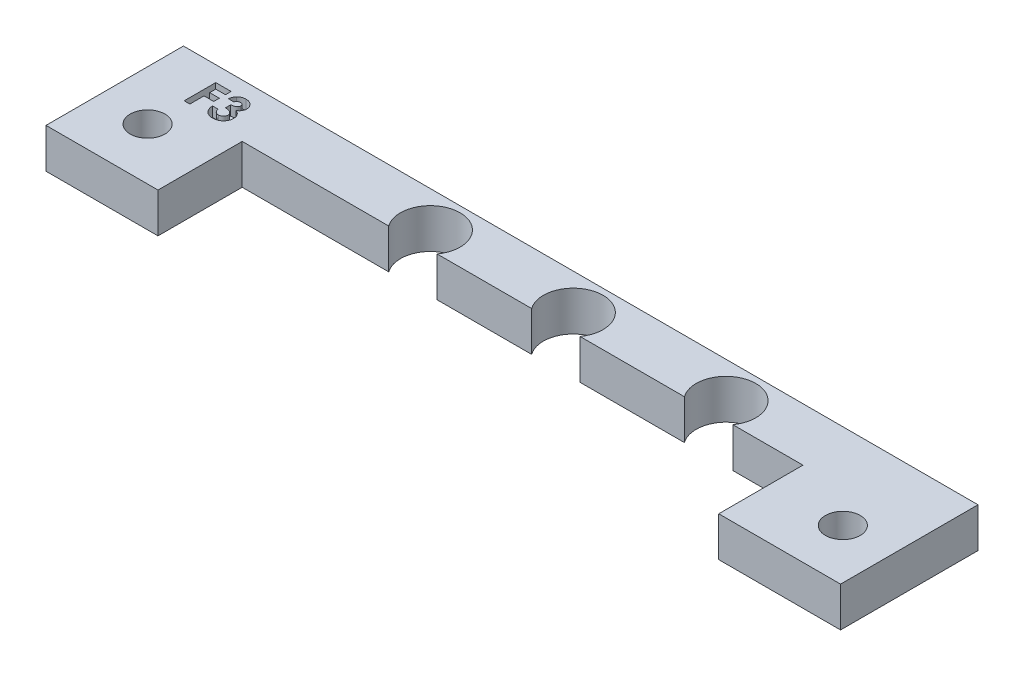
from build123d import *

# Parameters (mm, degrees)
SKETCH1_R           = 1.75
BOSS_EXTRUDE1_DEPTH = 4
CUT_EXTRUDE1_DEPTH  = 1


with BuildPart() as part:
    # Sketch1 → Boss-Extrude1 (new body)
    with BuildSketch(Plane(origin=(0, 0, 0), x_dir=(1, 0, 0), z_dir=(0, 1, 0))):
        with BuildLine():
            Line((-20.135223818, -18.81631321), (-8.860223818, -18.81631321))
            Line((-8.860223818, -18.81631321), (-8.860223818, -10.337442774))
            Line((-8.860223818, -10.337442774), (5.893076938, -10.33744141))
            ThreePointArc((5.893076938, -10.33744141), (8.329775763, -5.587442326), (10.766475916, -10.337440728))
            Line((10.766475916, -10.337440728), (20.283076449, -10.337440728))
            ThreePointArc((20.283076449, -10.337440728), (22.719776182, -5.587442326), (25.156475916, -10.337440728))
            Line((25.156475916, -10.337440728), (35.663076449, -10.337440728))
            ThreePointArc((35.663076449, -10.337440728), (38.099775199, -5.587442326), (40.536477064, -10.33743913))
            Line((40.536477064, -10.33743913), (47.599776182, -10.33743913))
            Line((47.599776182, -10.33743913), (47.599776182, -18.81631321))
            Line((47.599776182, -18.81631321), (59.864776182, -18.81631321))
            Line((59.864776182, -18.81631321), (59.864776182, -4.977918302))
            Line((59.864776182, -4.977918302), (-20.135223818, -4.977918302))
            Line((-20.135223818, -4.977918302), (-20.135223818, -18.81631321))
        make_face()
        with Locations((-15.135223818, -13.587440845)):
            Circle(SKETCH1_R, mode=Mode.SUBTRACT)
        with Locations((54.864776182, -13.587440845)):
            Circle(SKETCH1_R, mode=Mode.SUBTRACT)
    extrude(amount=BOSS_EXTRUDE1_DEPTH)

    # Sketch2 → Cut-Extrude1 (cut)
    with BuildSketch(Plane(origin=(0, 4, 0), x_dir=(1, 0, 0), z_dir=(0, 1, 0))):
        Polygon((-15.320752279, -6.539659084), (-13.773957408, -6.539659084), (-13.773957408, -7.109530878), (-14.750880484, -7.109530878), (-14.750880484, -7.720107802), (-13.773957408, -7.720107802), (-13.773957408, -8.289979596), (-14.750880484, -8.289979596), (-14.750880484, -9.714659084), (-15.320752279, -9.714659084), align=None)
        with BuildLine():
            Line((-12.715624074, -7.31305652), (-13.285495869, -7.31305652))
            add(Edge.make_bspline(
                [(-13.285495869, -7.31305652), (-13.281472358, -7.284570661), (-13.27358453, -7.228726024), (-13.254710012, -7.1478769), (-13.232134053, -7.071185973), (-13.20394912, -6.998896107), (-13.17089278, -6.93087853), (-13.133301178, -6.86689984), (-13.090767935, -6.807234643), (-13.058165754, -6.771292092), (-13.041901118, -6.753361007)],
                knots=[0, 0, 0, 0, 1.111473889, 2.178970933, 3.205615836, 4.199322666, 5.174200091, 6.12565194, 7.064921805, 8, 8, 8, 8], degree=3))
            add(Edge.make_bspline(
                [(-13.041901118, -6.753361007), (-13.018441535, -6.729702238), (-12.972205164, -6.683073292), (-12.894938765, -6.623346763), (-12.813949309, -6.571657514), (-12.727612518, -6.530677903), (-12.637271857, -6.497509656), (-12.542208906, -6.475230469), (-12.442812126, -6.460448032), (-12.374986328, -6.458991911), (-12.340373674, -6.458248827)],
                knots=[0, 0, 0, 0, 1.01925491, 2.00884431, 2.983262333, 3.955970413, 4.92937149, 5.924503185, 6.940838805, 8, 8, 8, 8], degree=3))
            add(Edge.make_bspline(
                [(-12.340373674, -6.458248827), (-12.309601243, -6.458975304), (-12.249108846, -6.460403411), (-12.160200243, -6.471867479), (-12.07543333, -6.491974177), (-11.993912097, -6.518263234), (-11.916835455, -6.554033889), (-11.842502249, -6.595556006), (-11.772989349, -6.646484608), (-11.70813411, -6.704028804), (-11.648552204, -6.766268484), (-11.596954011, -6.832797584), (-11.55259412, -6.901838958), (-11.516047437, -6.973966208), (-11.487948004, -7.049301384), (-11.468446164, -7.127409284), (-11.455681736, -7.208117556), (-11.454410065, -7.262973882), (-11.4537651, -7.290795903)],
                knots=[0, 0, 0, 0, 1.091422571, 2.145516843, 3.172569842, 4.178562979, 5.178154469, 6.181868002, 7.194278174, 8.227918432, 9.254613415, 10.245994977, 11.209837596, 12.161663635, 13.10878368, 14.055455738, 15.013766427, 16, 16, 16, 16], degree=3))
            add(Edge.make_bspline(
                [(-11.4537651, -7.290795903), (-11.455088608, -7.325251158), (-11.457694188, -7.393082963), (-11.479074861, -7.492359849), (-11.512541427, -7.58728627), (-11.560887138, -7.67653406), (-11.62133159, -7.759860338), (-11.695494907, -7.834479257), (-11.781264727, -7.901560739), (-11.845653274, -7.937610336), (-11.878624876, -7.956070342)],
                knots=[0, 0, 0, 0, 0.992805628, 1.954529043, 2.915727527, 3.886831945, 4.871318353, 5.87440735, 6.911542536, 8, 8, 8, 8], degree=3))
            add(Edge.make_bspline(
                [(-11.878624876, -7.956070342), (-11.855993674, -7.963500642), (-11.811524378, -7.978100848), (-11.748316621, -8.006855789), (-11.688213266, -8.038280173), (-11.632249272, -8.074787023), (-11.57986801, -8.114900165), (-11.531388801, -8.1589625), (-11.486521994, -8.206877951), (-11.446000021, -8.258910035), (-11.410035187, -8.314226601), (-11.377765856, -8.371549868), (-11.351206398, -8.431749155), (-11.328707231, -8.494136944), (-11.311577646, -8.559273944), (-11.299516887, -8.626907755), (-11.292545473, -8.6968841), (-11.291482213, -8.744293031), (-11.290944587, -8.768264853)],
                knots=[0, 0, 0, 0, 1.059543567, 2.081955587, 3.086750234, 4.076226789, 5.052108497, 6.020845489, 6.989030705, 7.970690546, 8.952259656, 9.923888338, 10.895517021, 11.877585046, 12.873342345, 13.889638361, 14.932918083, 16, 16, 16, 16], degree=3))
            add(Edge.make_bspline(
                [(-11.290944587, -8.768264853), (-11.292034427, -8.803493698), (-11.294183369, -8.872957806), (-11.30784534, -8.975271328), (-11.333281467, -9.072818182), (-11.366744101, -9.16672079), (-11.411379623, -9.255766904), (-11.463908129, -9.342000012), (-11.528476217, -9.422429573), (-11.600232559, -9.499181935), (-11.679922161, -9.568961747), (-11.766318654, -9.629457703), (-11.857522252, -9.681373997), (-11.954109976, -9.723521124), (-12.056048269, -9.755979232), (-12.163109918, -9.779441448), (-12.275744768, -9.793796021), (-12.352626866, -9.795300826), (-12.391891101, -9.79606934)],
                knots=[0, 0, 0, 0, 1.005138573, 1.981928558, 2.936866704, 3.876260664, 4.820238198, 5.773547, 6.751179199, 7.756627054, 8.768222608, 9.766606018, 10.760583154, 11.757261445, 12.767156078, 13.807575856, 14.880313354, 16, 16, 16, 16], degree=3))
            add(Edge.make_bspline(
                [(-12.391891101, -9.79606934), (-12.429034435, -9.795259071), (-12.501663309, -9.793674698), (-12.607898237, -9.779961147), (-12.708864481, -9.757840075), (-12.804819707, -9.726658589), (-12.895392673, -9.686221532), (-12.98140473, -9.638070069), (-13.061139525, -9.579426938), (-13.135485462, -9.512939399), (-13.202793323, -9.438344155), (-13.2629507, -9.357369168), (-13.314631113, -9.269706524), (-13.358046503, -9.175730754), (-13.39285746, -9.075276996), (-13.420316241, -8.968549527), (-13.439496649, -8.855339836), (-13.445338083, -8.77744916), (-13.448316382, -8.737736007)],
                knots=[0, 0, 0, 0, 1.066544725, 2.085487077, 3.070979577, 4.031932826, 4.977951092, 5.916076795, 6.857635327, 7.814973522, 8.776389752, 9.738577119, 10.707772778, 11.69409279, 12.707140348, 13.757286496, 14.856535458, 16, 16, 16, 16], degree=3))
            Line((-13.448316382, -8.737736007), (-12.878444587, -8.737736007))
            add(Edge.make_bspline(
                [(-12.878444587, -8.737736007), (-12.874833369, -8.757704302), (-12.867799575, -8.796597793), (-12.85408059, -8.852906922), (-12.836202839, -8.904883726), (-12.815531711, -8.952990173), (-12.793203781, -8.997857884), (-12.766226302, -9.037829784), (-12.736576042, -9.073991275), (-12.693790501, -9.116980452), (-12.632625623, -9.161150038), (-12.550032773, -9.199535509), (-12.45815605, -9.222034111), (-12.393925058, -9.224778872), (-12.360726238, -9.226197545)],
                knots=[0, 0, 0, 0, 0.928156231, 1.807827665, 2.648129825, 3.438902246, 4.202261636, 4.936546065, 5.639352463, 6.338805438, 7.70633318, 9.064371875, 10.482673459, 12, 12, 12, 12], degree=3))
            add(Edge.make_bspline(
                [(-12.360726238, -9.226197545), (-12.34310977, -9.225895452), (-12.308603052, -9.225303719), (-12.257917821, -9.218745152), (-12.209633001, -9.207943188), (-12.163658661, -9.193263718), (-12.119702124, -9.174862085), (-12.078603224, -9.15113428), (-12.039524263, -9.12354732), (-12.002890065, -9.092532254), (-11.969039311, -9.058736934), (-11.940873493, -9.021314358), (-11.915131973, -8.983286333), (-11.896093359, -8.94216493), (-11.879411432, -8.900162922), (-11.869201241, -8.855755765), (-11.861491813, -8.809875003), (-11.861043772, -8.778476224), (-11.860816382, -8.762540694)],
                knots=[0, 0, 0, 0, 1.110435564, 2.175094844, 3.216326037, 4.226890168, 5.215276772, 6.21526065, 7.213097102, 8.228249917, 9.239874822, 10.221364777, 11.178138315, 12.128914389, 13.072518965, 14.022636769, 14.996447288, 16, 16, 16, 16], degree=3))
            add(Edge.make_bspline(
                [(-11.860816382, -8.762540694), (-11.86142006, -8.745112478), (-11.862621845, -8.710416892), (-11.872440552, -8.65978598), (-11.887946365, -8.611083124), (-11.909485835, -8.564524002), (-11.938249395, -8.520280222), (-11.972190076, -8.47746412), (-12.013981841, -8.438304198), (-12.059833004, -8.399595801), (-12.113002341, -8.365853754), (-12.170900429, -8.334714802), (-12.235048922, -8.30993781), (-12.303881896, -8.287807366), (-12.378701392, -8.271643634), (-12.459042809, -8.259907189), (-12.544776544, -8.251171225), (-12.603873921, -8.249917907), (-12.634213818, -8.249274468)],
                knots=[0, 0, 0, 0, 0.809814727, 1.612155564, 2.388397, 3.182215007, 3.988903953, 4.837162975, 5.715530372, 6.646997145, 7.623086902, 8.637258368, 9.698941581, 10.815059213, 11.996518529, 13.252603015, 14.589518788, 16, 16, 16, 16], degree=3))
            Line((-12.634213818, -8.249274468), (-12.634213818, -7.720107802))
            add(Edge.make_bspline(
                [(-12.634213818, -7.720107802), (-12.596438842, -7.716890764), (-12.525769343, -7.710872323), (-12.42767629, -7.69679799), (-12.345094583, -7.677985328), (-12.276039371, -7.655288868), (-12.218700348, -7.626140701), (-12.168609294, -7.593962412), (-12.125468509, -7.556592032), (-12.089008758, -7.51514394), (-12.059842092, -7.470632577), (-12.039199625, -7.423749779), (-12.025568418, -7.37594616), (-12.024276862, -7.343249925), (-12.023636895, -7.327048907)],
                knots=[0, 0, 0, 0, 1.70044513, 3.18119609, 4.440695891, 5.496282586, 6.431922213, 7.318171381, 8.16090191, 8.983045123, 9.787564368, 10.536848927, 11.275007137, 12, 12, 12, 12], degree=3))
            add(Edge.make_bspline(
                [(-12.023636895, -7.327048907), (-12.024741021, -7.306378167), (-12.026896043, -7.26603326), (-12.043633107, -7.208291197), (-12.072686755, -7.156818934), (-12.111642594, -7.111724783), (-12.159111639, -7.074058769), (-12.214753681, -7.046713885), (-12.277361285, -7.030647544), (-12.321409108, -7.028982006), (-12.344189779, -7.028120622)],
                knots=[0, 0, 0, 0, 1.009664648, 1.970651636, 2.907870547, 3.878035693, 4.867062054, 5.849714035, 6.887914197, 8, 8, 8, 8], degree=3))
            add(Edge.make_bspline(
                [(-12.344189779, -7.028120622), (-12.364837897, -7.029136964), (-12.405810086, -7.031153699), (-12.46572369, -7.046206069), (-12.522621653, -7.071544861), (-12.575325778, -7.106485562), (-12.623075271, -7.148447862), (-12.662263828, -7.198143497), (-12.694859012, -7.252595115), (-12.708675252, -7.29282371), (-12.715624074, -7.31305652)],
                knots=[0, 0, 0, 0, 0.98818071, 1.960853194, 2.938124878, 3.957524365, 4.978590984, 5.968022688, 6.978025184, 8, 8, 8, 8], degree=3))
        make_face()
    extrude(amount=-CUT_EXTRUDE1_DEPTH, mode=Mode.SUBTRACT)


solid = part.part
